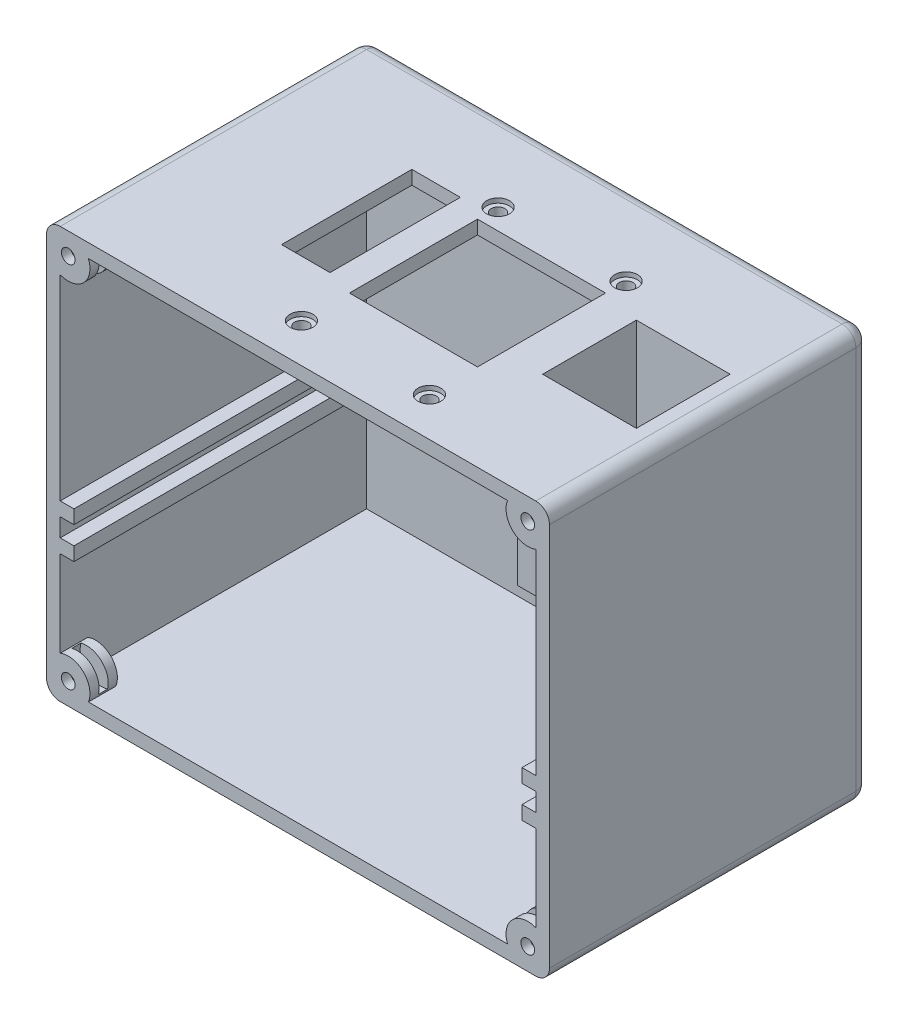
from build123d import *

# Parameters (mm, degrees)
SKETCH2_W           = 110
SKETCH2_H           = 90
BOSS_EXTRUDE1_DEPTH = 70
SKETCH4_W           = 104
SKETCH4_H           = 84
CUT_EXTRUDE1_DEPTH  = 67
FILLET6_R           = 3
FILLET7_R           = 3
FILLET8_R           = 3
FILLET9_R           = 3
FILLET10_R          = 3
SKETCH5_W           = 26
SKETCH5_H           = 26
BOSS_EXTRUDE2_DEPTH = 40
SKETCH7_W           = 20.5
SKETCH7_H           = 20.5
CUT_EXTRUDE2_DEPTH  = 40
SKETCH9_W           = 67
SKETCH9_H           = 3
BOSS_EXTRUDE3_DEPTH = 6
SKETCH10_W          = 67
SKETCH10_H          = 3
BOSS_EXTRUDE4_DEPTH = 6
SKETCH12_R          = 1.5
SKETCH12_W          = 28
SKETCH12_H          = 28
CUT_EXTRUDE4_DEPTH  = 6
SKETCH13_W          = 10.6
SKETCH13_H          = 28.5
CUT_EXTRUDE5_DEPTH  = 6
SKETCH14_R          = 4.75
SKETCH14_R_2        = 1.5
BOSS_EXTRUDE7_DEPTH = 6
CUT_EXTRUDE6_START  = -2
SKETCH16_R          = 4.75
SKETCH16_R_2        = 2.75
SKETCH16_R_3        = 1.5
CUT_EXTRUDE6_DEPTH  = 2
SKETCH17_R          = 2.5
CUT_EXTRUDE11_DEPTH = 1


with BuildPart() as part:
    # Sketch2 → Boss-Extrude1 (new body)
    with BuildSketch(Plane.XY):
        Rectangle(SKETCH2_W, SKETCH2_H)
    extrude(amount=BOSS_EXTRUDE1_DEPTH)

    # Sketch4 → Cut-Extrude1 (cut)
    with BuildSketch(Plane.XY.offset(70)):
        Rectangle(SKETCH4_W, SKETCH4_H)
    extrude(amount=-CUT_EXTRUDE1_DEPTH, mode=Mode.SUBTRACT)

    # Fillet6
    fillet6_edges = [part.edges().sort_by_distance(p)[0] for p in [
        (0, 45, 0),
        (55, 0, 0),
        (0, -45, 0),
        (-55, 0, 0),
    ]]
    fillet(fillet6_edges, radius=FILLET6_R)

    # Fillet7
    # the kernel refuses this fillet: 3 mm, written as the material it takes off along each edge
    with BuildSketch(Plane(origin=(52, 42, 3), x_dir=(0, 1, 0), z_dir=(1, 0, 0))) as fillet7_piece_1_section:
        Polygon((0, 0), (FILLET7_R, 0), (FILLET7_R, -FILLET7_R), (0, -FILLET7_R), align=None)
    fillet7_piece_1 = extrude(amount=FILLET7_R, mode=Mode.PRIVATE)
    fillet7_piece_1 = fillet7_piece_1 - Plane(origin=(52, 42, 3), x_dir=(0, -0.7071067811865475, 0.7071067811865475), z_dir=(1, 0, 0)) * Sphere(FILLET7_R, mode=Mode.PRIVATE)
    add(fillet7_piece_1, mode=Mode.SUBTRACT)
    with BuildSketch(Plane(origin=(55, 45, 3), x_dir=(0, -1, 0), z_dir=(0, 0, 1))) as fillet7_piece_2:
        with BuildLine():
            CenterArc((FILLET7_R, -FILLET7_R), FILLET7_R, 90, 90)
            Line((0, -FILLET7_R), (0, 0))
            Line((0, 0), (FILLET7_R, 0))
        make_face()
    extrude(amount=74.5, mode=Mode.SUBTRACT)

    # Fillet8
    # the kernel refuses this fillet: 3 mm, written as the material it takes off along each edge
    with BuildSketch(Plane(origin=(52, -42, 3), x_dir=(1, 0, 0), z_dir=(0, -1, 0))) as fillet8_piece_1_section:
        Polygon((0, 0), (FILLET8_R, 0), (FILLET8_R, -FILLET8_R), (0, -FILLET8_R), align=None)
    fillet8_piece_1 = extrude(amount=FILLET8_R, mode=Mode.PRIVATE)
    fillet8_piece_1 = fillet8_piece_1 - Plane(origin=(52, -42, 3), x_dir=(-0.7071067811865475, 0, 0.7071067811865475), z_dir=(0, -1, 0)) * Sphere(FILLET8_R, mode=Mode.PRIVATE)
    add(fillet8_piece_1, mode=Mode.SUBTRACT)
    with BuildSketch(Plane(origin=(55, -45, 3), x_dir=(-1, 0, 0), z_dir=(0, 0, 1))) as fillet8_piece_2:
        with BuildLine():
            CenterArc((FILLET8_R, -FILLET8_R), FILLET8_R, 90, 90)
            Line((0, -FILLET8_R), (0, 0))
            Line((0, 0), (FILLET8_R, 0))
        make_face()
    extrude(amount=74.5, mode=Mode.SUBTRACT)

    # Fillet9
    # the kernel refuses this fillet: 3 mm, written as the material it takes off along each edge
    with BuildSketch(Plane(origin=(-52, -42, 3), x_dir=(-1, 0, 0), z_dir=(0, -1, 0))) as fillet9_piece_1_section:
        Polygon((0, 0), (FILLET9_R, 0), (FILLET9_R, FILLET9_R), (0, FILLET9_R), align=None)
    fillet9_piece_1 = extrude(amount=FILLET9_R, mode=Mode.PRIVATE)
    fillet9_piece_1 = fillet9_piece_1 - Plane(origin=(-52, -42, 3), x_dir=(0.7071067811865475, 0, 0.7071067811865475), z_dir=(0, -1, 0)) * Sphere(FILLET9_R, mode=Mode.PRIVATE)
    add(fillet9_piece_1, mode=Mode.SUBTRACT)
    with BuildSketch(Plane(origin=(-55, -45, 3), x_dir=(1, 0, 0), z_dir=(0, 0, 1))) as fillet9_piece_2:
        with BuildLine():
            CenterArc((FILLET9_R, FILLET9_R), FILLET9_R, 180, 90)
            Line((0, FILLET9_R), (0, 0))
            Line((0, 0), (FILLET9_R, 0))
        make_face()
    extrude(amount=74.5, mode=Mode.SUBTRACT)

    # Fillet10
    # the kernel refuses this fillet: 3 mm, written as the material it takes off along each edge
    with BuildSketch(Plane(origin=(-52, 42, 3), x_dir=(0, 1, 0), z_dir=(-1, 0, 0))) as fillet10_piece_1_section:
        Polygon((0, 0), (FILLET10_R, 0), (FILLET10_R, FILLET10_R), (0, FILLET10_R), align=None)
    fillet10_piece_1 = extrude(amount=FILLET10_R, mode=Mode.PRIVATE)
    fillet10_piece_1 = fillet10_piece_1 - Plane(origin=(-52, 42, 3), x_dir=(0, -0.7071067811865475, 0.7071067811865475), z_dir=(-1, 0, 0)) * Sphere(FILLET10_R, mode=Mode.PRIVATE)
    add(fillet10_piece_1, mode=Mode.SUBTRACT)
    with BuildSketch(Plane(origin=(-55, 45, 3), x_dir=(0, -1, 0), z_dir=(0, 0, 1))) as fillet10_piece_2:
        with BuildLine():
            CenterArc((FILLET10_R, FILLET10_R), FILLET10_R, 180, 90)
            Line((0, FILLET10_R), (0, 0))
            Line((0, 0), (FILLET10_R, 0))
        make_face()
    extrude(amount=74.5, mode=Mode.SUBTRACT)

    # Sketch5 → Boss-Extrude2 (add)
    with BuildSketch(Plane(origin=(0, 45, 0), x_dir=(1, 0, 0), z_dir=(0, 1, 0))):
        with Locations((39, -35)):
            Rectangle(SKETCH5_W, SKETCH5_H)
    extrude(amount=-BOSS_EXTRUDE2_DEPTH)

    # Sketch7 → Cut-Extrude2 (cut)
    with BuildSketch(Plane.XZ.offset(-5)):
        with Locations((39, 35)):
            Rectangle(SKETCH7_W, SKETCH7_H)
    extrude(amount=-CUT_EXTRUDE2_DEPTH, mode=Mode.SUBTRACT)

    # Sketch9 → Boss-Extrude3 (add)
    with BuildSketch(Plane.ZY.offset(55)):
        with Locations((36.5, -15.5)):
            Rectangle(SKETCH9_W, SKETCH9_H)
        with Locations((36.5, -8.5)):
            Rectangle(SKETCH9_W, SKETCH9_H)
    extrude(amount=-BOSS_EXTRUDE3_DEPTH)

    # Sketch10 → Boss-Extrude4 (add)
    with BuildSketch(Plane(origin=(55, 0, 0), x_dir=(0, 0, -1), z_dir=(1, 0, 0))):
        with Locations((-36.5, -15.5)):
            Rectangle(SKETCH10_W, SKETCH10_H)
        with Locations((-36.5, -8.5)):
            Rectangle(SKETCH10_W, SKETCH10_H)
    extrude(amount=-BOSS_EXTRUDE4_DEPTH)

    # Sketch12 → Cut-Extrude4 (cut)
    with BuildSketch(Plane(origin=(0, 45, 0), x_dir=(1, 0, 0), z_dir=(0, 1, 0))):
        with Locations(Location((-7.75, -18.5, 0), (0, 0, 180))):
            Circle(SKETCH12_R)
        with Locations(Location((20.25, -18.5, 0), (0, 0, 180))):
            Circle(SKETCH12_R)
        with Locations(Location((-7.75, -61.5, 0), (0, 0, 180))):
            Circle(SKETCH12_R)
        with Locations(Location((20.25, -61.5, 0), (0, 0, 180))):
            Circle(SKETCH12_R)
        with Locations((6.25, -37)):
            Rectangle(SKETCH12_W, SKETCH12_H)
    extrude(amount=-CUT_EXTRUDE4_DEPTH, mode=Mode.SUBTRACT)

    # Sketch13 → Cut-Extrude5 (cut)
    with BuildSketch(Plane(origin=(0, 45, 0), x_dir=(1, 0, 0), z_dir=(0, 1, 0))):
        with Locations((-19.05, -35)):
            Rectangle(SKETCH13_W, SKETCH13_H)
    extrude(amount=-CUT_EXTRUDE5_DEPTH, mode=Mode.SUBTRACT)

    # Sketch14 → Boss-Extrude7 (add)
    # profile 1 of 4: a face of its own
    with BuildSketch(Plane.XY.offset(70)):
        with Locations((-50.25, 40.25)):
            Circle(SKETCH14_R)
        with Locations((-50.25, 40.25)):
            Circle(SKETCH14_R_2, mode=Mode.SUBTRACT)
    # profile 2 of 4: a face of its own
    with BuildSketch(Plane.XY.offset(70)):
        with Locations((50.25, 40.25)):
            Circle(SKETCH14_R)
        with Locations((50.25, 40.25)):
            Circle(SKETCH14_R_2, mode=Mode.SUBTRACT)
    # profile 3 of 4: a face of its own
    with BuildSketch(Plane.XY.offset(70)):
        with Locations((-50.25, -40.25)):
            Circle(SKETCH14_R)
        with Locations((-50.25, -40.25)):
            Circle(SKETCH14_R_2, mode=Mode.SUBTRACT)
    # profile 4 of 4: a face of its own
    with BuildSketch(Plane.XY.offset(70)):
        with Locations((50.25, -40.25)):
            Circle(SKETCH14_R)
        with Locations((50.25, -40.25)):
            Circle(SKETCH14_R_2, mode=Mode.SUBTRACT)
    extrude(amount=-BOSS_EXTRUDE7_DEPTH)

    # Sketch16 → Cut-Extrude6 (cut)
    # profile 1 of 24: a face of its own
    with BuildSketch(Plane.XY.offset(70).offset(CUT_EXTRUDE6_START)):
        with Locations((-46.891242789, -36.891242789)):
            Circle(SKETCH16_R)
    # profile 2 of 24: a face of its own
    with BuildSketch(Plane.XY.offset(70).offset(CUT_EXTRUDE6_START)):
        with Locations((-50.25, -40.25)):
            Circle(SKETCH16_R_2)
        with Locations((-50.25, -40.25)):
            Circle(SKETCH16_R_3, mode=Mode.SUBTRACT)
    # profile 3 of 24: a face of its own
    with BuildSketch(Plane.XY.offset(70).offset(CUT_EXTRUDE6_START)):
        with BuildLine():
            ThreePointArc((-42.141242789, -36.891242789), (-46.271243376, -32.181879698), (-51.479390464, -35.661852325))
            ThreePointArc((-51.479390464, -35.661852325), (-46.891242789, -36.891242789), (-45.661852325, -41.479390464))
            ThreePointArc((-45.661852325, -41.479390464), (-43.122814423, -39.782859577), (-42.141242789, -36.891242789))
        make_face()
    # profile 4 of 24: a face of its own
    with BuildSketch(Plane.XY.offset(70).offset(CUT_EXTRUDE6_START)):
        with BuildLine():
            ThreePointArc((-51.548395689, -37.825815883), (-48.837216957, -37.890647531), (-47.5, -40.25))
            ThreePointArc((-47.5, -40.25), (-47.5826974, -40.91932566), (-47.825815883, -41.548395689))
            ThreePointArc((-47.825815883, -41.548395689), (-46.739850085, -41.638829571), (-45.661852325, -41.479390464))
            ThreePointArc((-45.661852325, -41.479390464), (-46.891242789, -36.891242789), (-51.479390464, -35.661852325))
            ThreePointArc((-51.479390464, -35.661852325), (-51.638829571, -36.739850085), (-51.548395689, -37.825815883))
        make_face()
    # profile 5 of 24: a face of its own
    with BuildSketch(Plane.XY.offset(70).offset(CUT_EXTRUDE6_START)):
        with Locations((-50.25, -40.25)):
            Circle(SKETCH16_R_2)
        with Locations((-50.25, -40.25)):
            Circle(SKETCH16_R_3, mode=Mode.SUBTRACT)
    # profile 6 of 24: a face of its own
    with BuildSketch(Plane.XY.offset(70).offset(CUT_EXTRUDE6_START)):
        with Locations((-46.891242789, -36.891242789)):
            Circle(SKETCH16_R)
    # profile 7 of 24: a face of its own
    with BuildSketch(Plane.XY.offset(70).offset(CUT_EXTRUDE6_START)):
        with Locations((46.891242789, -36.891242789)):
            Circle(SKETCH16_R)
    # profile 8 of 24: a face of its own
    with BuildSketch(Plane.XY.offset(70).offset(CUT_EXTRUDE6_START)):
        with Locations((50.25, -40.25)):
            Circle(SKETCH16_R_2)
        with Locations((50.25, -40.25)):
            Circle(SKETCH16_R_3, mode=Mode.SUBTRACT)
    # profile 9 of 24: a face of its own
    with BuildSketch(Plane.XY.offset(70).offset(CUT_EXTRUDE6_START)):
        with Locations((50.25, -40.25)):
            Circle(SKETCH16_R_2)
        with Locations((50.25, -40.25)):
            Circle(SKETCH16_R_3, mode=Mode.SUBTRACT)
    # profile 10 of 24: a face of its own
    with BuildSketch(Plane.XY.offset(70).offset(CUT_EXTRUDE6_START)):
        with Locations((46.891242789, -36.891242789)):
            Circle(SKETCH16_R)
    # profile 11 of 24: a face of its own
    with BuildSketch(Plane.XY.offset(70).offset(CUT_EXTRUDE6_START)):
        with BuildLine():
            ThreePointArc((47.825815883, -41.548395689), (48.305456352, -38.305456352), (51.548395689, -37.825815883))
            ThreePointArc((51.548395689, -37.825815883), (51.617974021, -37.360829696), (51.641242789, -36.891242789))
            ThreePointArc((51.641242789, -36.891242789), (51.600605881, -36.271243376), (51.479390464, -35.661852325))
            ThreePointArc((51.479390464, -35.661852325), (46.891242789, -36.891242789), (45.661852325, -41.479390464))
            ThreePointArc((45.661852325, -41.479390464), (46.739850085, -41.638829571), (47.825815883, -41.548395689))
        make_face()
    # profile 12 of 24: a face of its own
    with BuildSketch(Plane.XY.offset(70).offset(CUT_EXTRUDE6_START)):
        with BuildLine():
            ThreePointArc((51.479390464, -35.661852325), (43.532485579, -33.532485579), (45.661852325, -41.479390464))
            ThreePointArc((45.661852325, -41.479390464), (46.891242789, -36.891242789), (51.479390464, -35.661852325))
        make_face()
    # profile 13 of 24: a face of its own
    with BuildSketch(Plane.XY.offset(70).offset(CUT_EXTRUDE6_START)):
        with Locations((46.891242789, 36.891242789)):
            Circle(SKETCH16_R)
    # profile 14 of 24: a face of its own
    with BuildSketch(Plane.XY.offset(70).offset(CUT_EXTRUDE6_START)):
        with Locations((50.25, 40.25)):
            Circle(SKETCH16_R_2)
        with Locations((50.25, 40.25)):
            Circle(SKETCH16_R_3, mode=Mode.SUBTRACT)
    # profile 15 of 24: a face of its own
    with BuildSketch(Plane.XY.offset(70).offset(CUT_EXTRUDE6_START)):
        with Locations((50.25, 40.25)):
            Circle(SKETCH16_R_2)
        with Locations((50.25, 40.25)):
            Circle(SKETCH16_R_3, mode=Mode.SUBTRACT)
    # profile 16 of 24: a face of its own
    with BuildSketch(Plane.XY.offset(70).offset(CUT_EXTRUDE6_START)):
        with Locations((46.891242789, 36.891242789)):
            Circle(SKETCH16_R)
    # profile 17 of 24: a face of its own
    with BuildSketch(Plane.XY.offset(70).offset(CUT_EXTRUDE6_START)):
        with BuildLine():
            ThreePointArc((51.548395689, 37.825815883), (48.305456352, 38.305456352), (47.825815883, 41.548395689))
            ThreePointArc((47.825815883, 41.548395689), (46.739850085, 41.638829571), (45.661852325, 41.479390464))
            ThreePointArc((45.661852325, 41.479390464), (46.891242789, 36.891242789), (51.479390464, 35.661852325))
            ThreePointArc((51.479390464, 35.661852325), (51.600605881, 36.271243376), (51.641242789, 36.891242789))
            ThreePointArc((51.641242789, 36.891242789), (51.617974021, 37.360829696), (51.548395689, 37.825815883))
        make_face()
    # profile 18 of 24: a face of its own
    with BuildSketch(Plane.XY.offset(70).offset(CUT_EXTRUDE6_START)):
        with BuildLine():
            ThreePointArc((51.479390464, 35.661852325), (46.891242789, 36.891242789), (45.661852325, 41.479390464))
            ThreePointArc((45.661852325, 41.479390464), (43.532485579, 33.532485579), (51.479390464, 35.661852325))
        make_face()
    # profile 19 of 24: a face of its own
    with BuildSketch(Plane.XY.offset(70).offset(CUT_EXTRUDE6_START)):
        with BuildLine():
            ThreePointArc((-42.141242789, 36.891242789), (-43.122814423, 39.782859577), (-45.661852325, 41.479390464))
            ThreePointArc((-45.661852325, 41.479390464), (-46.891242789, 36.891242789), (-51.479390464, 35.661852325))
            ThreePointArc((-51.479390464, 35.661852325), (-46.271243376, 32.181879698), (-42.141242789, 36.891242789))
        make_face()
    # profile 20 of 24: a face of its own
    with BuildSketch(Plane.XY.offset(70).offset(CUT_EXTRUDE6_START)):
        with BuildLine():
            ThreePointArc((-47.825815883, 41.548395689), (-47.5826974, 40.91932566), (-47.5, 40.25))
            ThreePointArc((-47.5, 40.25), (-48.837216957, 37.890647531), (-51.548395689, 37.825815883))
            ThreePointArc((-51.548395689, 37.825815883), (-51.638829571, 36.739850085), (-51.479390464, 35.661852325))
            ThreePointArc((-51.479390464, 35.661852325), (-46.891242789, 36.891242789), (-45.661852325, 41.479390464))
            ThreePointArc((-45.661852325, 41.479390464), (-46.739850085, 41.638829571), (-47.825815883, 41.548395689))
        make_face()
    # profile 21 of 24: a face of its own
    with BuildSketch(Plane.XY.offset(70).offset(CUT_EXTRUDE6_START)):
        with Locations((-50.25, 40.25)):
            Circle(SKETCH16_R_2)
        with Locations((-50.25, 40.25)):
            Circle(SKETCH16_R_3, mode=Mode.SUBTRACT)
    # profile 22 of 24: a face of its own
    with BuildSketch(Plane.XY.offset(70).offset(CUT_EXTRUDE6_START)):
        with Locations((-46.891242789, 36.891242789)):
            Circle(SKETCH16_R)
    # profile 23 of 24: a face of its own
    with BuildSketch(Plane.XY.offset(70).offset(CUT_EXTRUDE6_START)):
        with Locations((-46.891242789, 36.891242789)):
            Circle(SKETCH16_R)
    # profile 24 of 24: a face of its own
    with BuildSketch(Plane.XY.offset(70).offset(CUT_EXTRUDE6_START)):
        with Locations((-50.25, 40.25)):
            Circle(SKETCH16_R_2)
        with Locations((-50.25, 40.25)):
            Circle(SKETCH16_R_3, mode=Mode.SUBTRACT)
    extrude(amount=-CUT_EXTRUDE6_DEPTH, mode=Mode.SUBTRACT)

    # Sketch17 → Cut-Extrude11 (cut)
    with BuildSketch(Plane(origin=(0, 45, 0), x_dir=(1, 0, 0), z_dir=(0, 1, 0))):
        with Locations(Location((-7.75, -18.5, 0), (0, 0, 180))):
            Circle(SKETCH17_R)
        with Locations(Location((20.25, -18.5, 0), (0, 0, 180))):
            Circle(SKETCH17_R)
        with Locations(Location((-7.75, -61.5, 0), (0, 0, 180))):
            Circle(SKETCH17_R)
        with Locations(Location((20.25, -61.5, 0), (0, 0, 180))):
            Circle(SKETCH17_R)
    extrude(amount=-CUT_EXTRUDE11_DEPTH, mode=Mode.SUBTRACT)


solid = part.part
